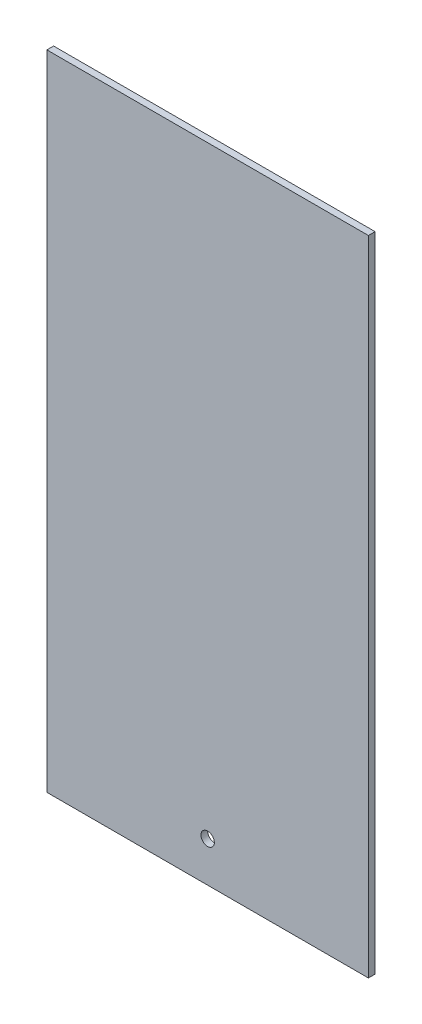
from build123d import *

# Parameters (mm, degrees)
SKETCH1_W           = 152.4
SKETCH1_H           = 304.8
BOSS_EXTRUDE1_DEPTH = 3.175
SKETCH2_R           = 3.175
CUT_EXTRUDE1_DEPTH  = 171.417958634


with BuildPart() as part:
    # Sketch1 → Boss-Extrude1 (new body)
    with BuildSketch(Plane.XY):
        Rectangle(SKETCH1_W, SKETCH1_H)
    extrude(amount=BOSS_EXTRUDE1_DEPTH)

    # Sketch2 → Cut-Extrude1 (cut, through all)
    with BuildSketch(Plane.XY.offset(3.175)):
        with Locations((0, -133.35)):
            Circle(SKETCH2_R)
    extrude(amount=-CUT_EXTRUDE1_DEPTH, mode=Mode.SUBTRACT)


solid = part.part
